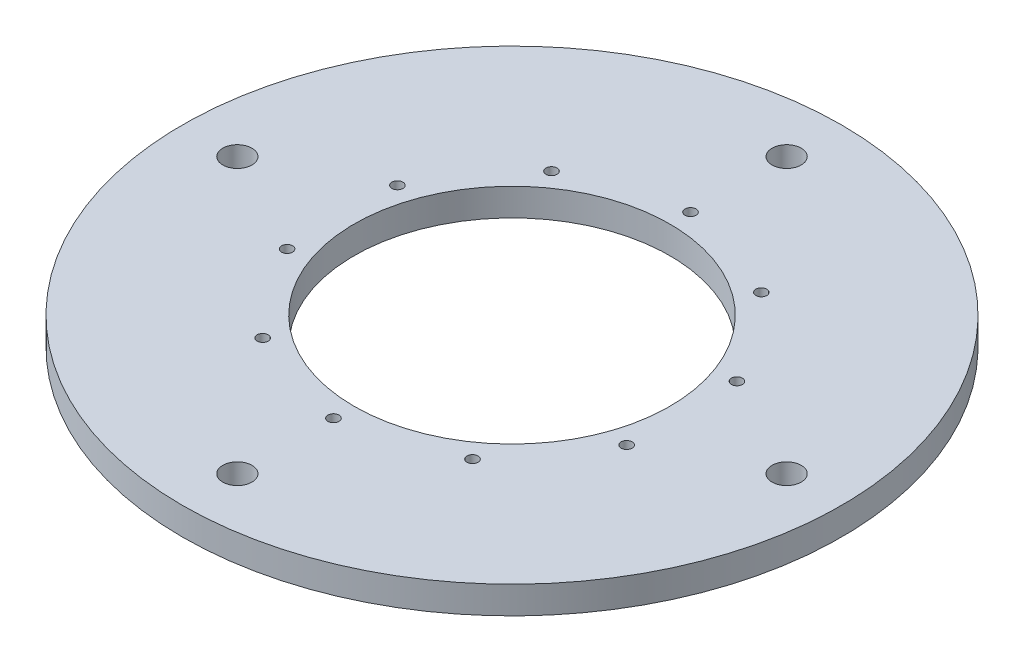
from build123d import *

# Parameters (mm, degrees)
SKETCH1_R                           = 152.4
SKETCH1_R_2                         = 73.025
THRUSTPLATE_TC3_DEPTH               = 12.7
UNDEF_CLEARANCE_THRUSTPLATE_D       = 13.49248
CLEARANCE_THRUSTPLATE_PATTERN_COUNT = 4
F_10_CLEARANCE_HOLE1_D              = 5.1054
CIRPATTERN1_COUNT                   = 10


with BuildPart() as part:
    # Sketch1 → ThrustPlate_TC3 (new body)
    with BuildSketch(Plane(origin=(0, 0, 0), x_dir=(1, 0, 0), z_dir=(0, 1, 0))):
        Circle(SKETCH1_R)
        Circle(SKETCH1_R_2, mode=Mode.SUBTRACT)
    extrude(amount=-THRUSTPLATE_TC3_DEPTH)

    # UNDEF_Clearance_ThrustPlate (through all)
    with Locations(Plane(origin=(0, 0, 0), x_dir=(1, 0, 0), z_dir=(0, 1, 0))):
        with Locations((0, 127)):
            undef_clearance_thrustplate = Hole(UNDEF_CLEARANCE_THRUSTPLATE_D / 2)

    # Clearance_ThrustPlate_Pattern: UNDEF_Clearance_ThrustPlate ×4 about axis
    clearance_thrustplate_pattern_axis = Axis((0, -12.7, 0), (0, 1, 0))
    for i in range(1, CLEARANCE_THRUSTPLATE_PATTERN_COUNT):
        add(undef_clearance_thrustplate.rotate(clearance_thrustplate_pattern_axis, i * 360 / CLEARANCE_THRUSTPLATE_PATTERN_COUNT), mode=Mode.SUBTRACT)

    # #10 Clearance Hole1 (through all)
    with Locations(Plane(origin=(0, 0, 0), x_dir=(1, 0, 0), z_dir=(0, 1, 0))):
        with Locations((0, 82.55)):
            f_10_clearance_hole1 = Hole(F_10_CLEARANCE_HOLE1_D / 2)

    # CirPattern1: #10 Clearance Hole1 ×10 about axis
    cirpattern1_axis = Axis((0, -12.7, 0), (0, 1, 0))
    for i in range(1, CIRPATTERN1_COUNT):
        add(f_10_clearance_hole1.rotate(cirpattern1_axis, i * 360 / CIRPATTERN1_COUNT), mode=Mode.SUBTRACT)


solid = part.part
